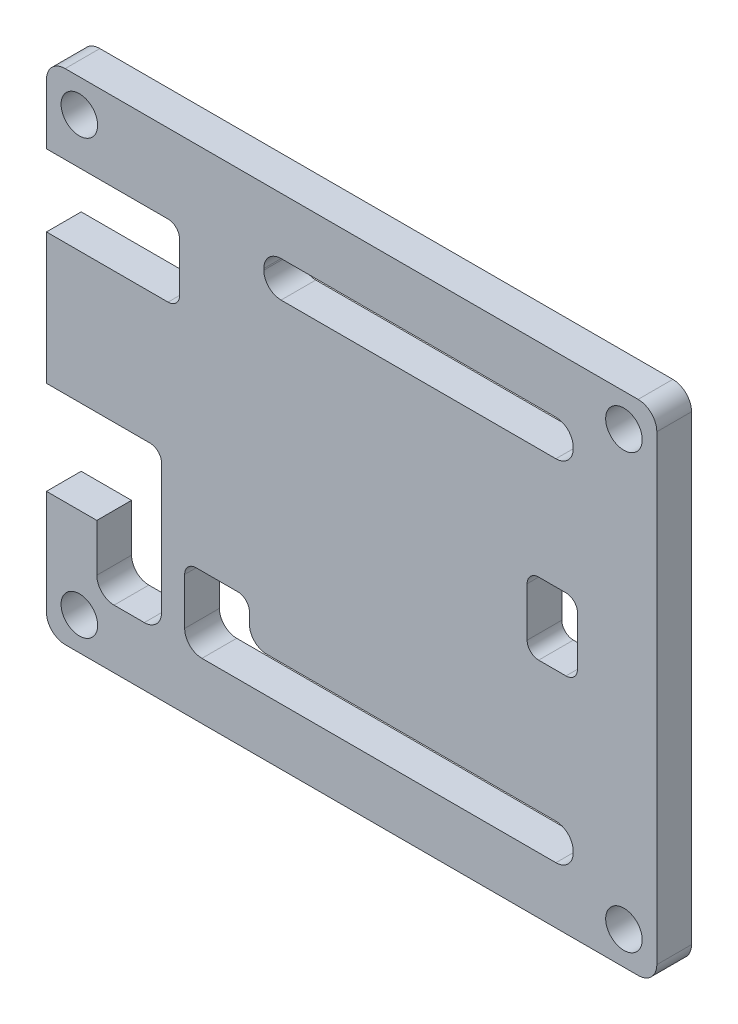
from build123d import *

# Parameters (mm, degrees)
SKETCH1_W          = 84.836
SKETCH1_H          = 69.342
BASE_FLANGE1_DEPTH = 4.826
SKETCH6_R          = 2.54
CUT_EXTRUDE1_DEPTH = 10
FILLET1_R          = 2.6
SKETCH7_W          = 18.5
SKETCH7_H          = 10
SKETCH7_W_2        = 43
SKETCH7_H_2        = 5
SKETCH7_W_3        = 7
CUT_EXTRUDE2_DEPTH = 4.826
FILLET2_R          = 2.4
FILLET3_R          = 1.6


# Sheet-metal steps are written as plain solids
with BuildPart() as part:
    # Sketch1 → Base-Flange1 (new body)
    with BuildSketch(Plane.XY):
        Rectangle(SKETCH1_W, SKETCH1_H)
    extrude(amount=-BASE_FLANGE1_DEPTH)

    # Sketch6 → Cut-Extrude1 (cut)
    with BuildSketch(Plane.XY):
        with Locations((-37.846, 30.099)):
            Circle(SKETCH6_R)
        with Locations(Location((-37.846, -30.099, 0), (0, 0, 180))):
            Circle(SKETCH6_R)
        with Locations((37.846, -30.099)):
            Circle(SKETCH6_R)
        with Locations(Location((37.846, 30.099, 0), (0, 0, 180))):
            Circle(SKETCH6_R)
    extrude(amount=-CUT_EXTRUDE1_DEPTH, mode=Mode.SUBTRACT)

    # Fillet1
    fillet1_edges = [part.edges().sort_by_distance(p)[0] for p in [
        (-42.418, 34.671, -2.413),
        (42.418, 34.671, -2.413),
        (42.418, -34.671, -2.413),
        (-42.418, -34.671, -2.413),
    ]]
    fillet(fillet1_edges, radius=FILLET1_R)

    # Sketch7 → Cut-Extrude2 (cut)
    with BuildSketch(Plane.XY):
        with Locations((-33.168, 18.7119922)):
            Rectangle(SKETCH7_W, SKETCH7_H)
        Polygon((-42.418, -4.5120046), (-26.418, -4.5120046), (-26.418, -26.512012), (-35.418, -26.512012), (-35.418, -17.5120046), (-42.418, -17.5120046), align=None)
        with Locations((9.2919882, 24.3120114)):
            Rectangle(SKETCH7_W_2, SKETCH7_H_2)
        Polygon((-14.2080118, -21.81200997), (-14.2080118, -16.31199997), (-23.2080118, -16.31199997), (-23.2080118, -26.81199997), (30.7919882, -26.81199997), (30.7919882, -21.81200997), align=None)
        with Locations((27.8920124, 1.371)):
            Rectangle(SKETCH7_W_3, SKETCH7_H)
    extrude(amount=-CUT_EXTRUDE2_DEPTH, mode=Mode.SUBTRACT)

    # Fillet2
    fillet2_edges = [part.edges().sort_by_distance(p)[0] for p in [
        (-12.2080118, 21.8120114, -2.413),
        (-12.2080118, 26.8120114, -2.413),
        (30.7919882, 26.8120114, -2.413),
        (30.7919882, 21.8120114, -2.413),
        (30.7919882, -21.81200997, -2.413),
        (30.7919882, -26.81199997, -2.413),
        (-23.2080118, -26.81199997, -2.413),
        (-14.2080118, -21.81200997, -2.413),
        (-26.418, -26.512012, -2.413),
        (-35.418, -26.512012, -2.413),
    ]]
    fillet(fillet2_edges, radius=FILLET2_R)

    # Fillet3
    fillet3_edges = [part.edges().sort_by_distance(p)[0] for p in [
        (24.3920124, -3.629, -2.413),
        (24.3920124, 6.371, -2.413),
        (31.3920124, 6.371, -2.413),
        (31.3920124, -3.629, -2.413),
        (-23.2080118, -16.31199997, -2.413),
        (-14.2080118, -16.31199997, -2.413),
        (-23.918, 23.7119922, -2.413),
        (-23.918, 13.7119922, -2.413),
        (-26.418, -4.5120046, -2.413),
    ]]
    fillet(fillet3_edges, radius=FILLET3_R)


solid = part.part
